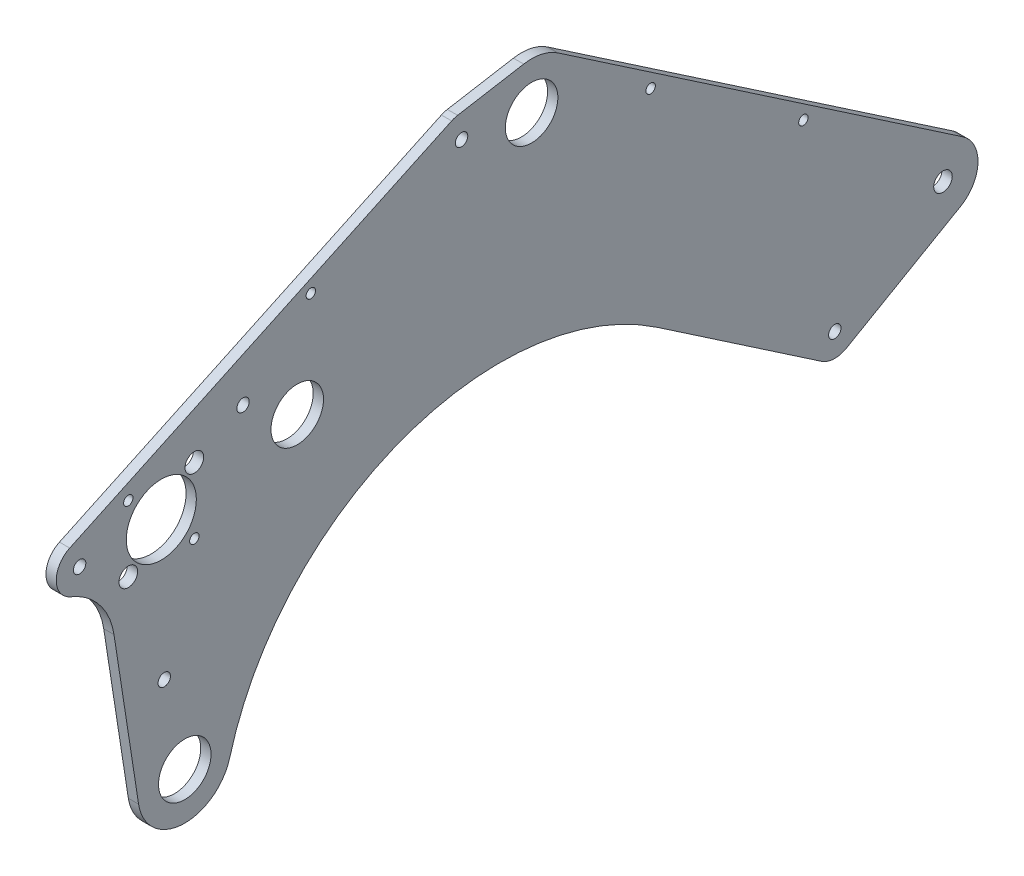
from build123d import *

# Parameters (mm, degrees)
SKETCH2_R           = 14.2875
SKETCH2_R_2         = 19.05
SKETCH2_R_3         = 5.0419
SKETCH2_R_4         = 3.3782
SKETCH2_R_5         = 5.08
SKETCH2_R_6         = 2.5527
BOSS_EXTRUDE1_DEPTH = 5.588
SKETCH4_R           = 2.5527
CUT_EXTRUDE1_DEPTH  = 512.363731997


with BuildPart() as part:
    # Sketch2 → Boss-Extrude1 (new body)
    with BuildSketch(Plane(origin=(0, 0, 0), x_dir=(0, 0, -1), z_dir=(1, 0, 0))):
        with BuildLine():
            Line((-437.546257165, -74.524343451), (-450.925675972, 12.053916333))
            ThreePointArc((-450.925675972, 12.053916333), (-458.738197339, 29.923843863), (-474.369924043, 41.586558826))
            ThreePointArc((-474.369924043, 41.586558826), (-482.328689132, 53.015195424), (-475.021326618, 64.870916799))
            Line((-475.021326618, 64.870916799), (-267.255494276, 162.202987762))
            ThreePointArc((-267.255494276, 162.202987762), (-265.669363705, 162.82010746), (-264.014960339, 163.219602661))
            Line((-264.014960339, 163.219602661), (-228.062096944, 169.38678303))
            ThreePointArc((-228.062096944, 169.38678303), (-218.387406017, 169.176022054), (-209.493675138, 165.362150558))
            Line((-209.493675138, 165.362150558), (10.705611447, 15.7572962))
            ThreePointArc((10.705611447, 15.7572962), (19.036817115, -0.708586016), (9.504578676, -16.509557359))
            Line((9.504578676, -16.509557359), (-52.513175494, -52.213278))
            ThreePointArc((-52.513175494, -52.213278), (-59.321951956, -53.898117837), (-65.986635577, -51.711770561))
            Line((-65.986635577, -51.711770561), (-155.192448972, 8.895250142))
            ThreePointArc((-155.192448972, 8.895250142), (-293.761109642, 25.752361384), (-387.928953664, -77.29060573))
            ThreePointArc((-387.928953664, -77.29060573), (-413.858126783, -96.005803383), (-437.546257165, -74.524343451))
        make_face()
        with Locations((-223.767823734, 144.352422291)):
            Circle(SKETCH2_R, mode=Mode.SUBTRACT)
        with Locations((-351.246969331, 65.939769964)):
            Circle(SKETCH2_R, mode=Mode.SUBTRACT)
        with Locations((-412.444222517, -70.645186775)):
            Circle(SKETCH2_R, mode=Mode.SUBTRACT)
        with Locations((-425.183656076, 53.370351328)):
            Circle(SKETCH2_R_2, mode=Mode.SUBTRACT)
        Circle(SKETCH2_R_3, mode=Mode.SUBTRACT)
        with Locations((-58.849561279, -41.206906428)):
            Circle(SKETCH2_R_4, mode=Mode.SUBTRACT)
        with Locations((-261.867823734, 150.702422291)):
            Circle(SKETCH2_R_4, mode=Mode.SUBTRACT)
        with Locations((-407.223143834, 71.330863571)):
            Circle(SKETCH2_R_5, mode=Mode.SUBTRACT)
        with Locations((-443.144168318, 71.330863571)):
            Circle(SKETCH2_R_6, mode=Mode.SUBTRACT)
        with Locations((-443.144168318, 35.409839086)):
            Circle(SKETCH2_R_5, mode=Mode.SUBTRACT)
        with Locations((-407.223143834, 35.409839086)):
            Circle(SKETCH2_R_6, mode=Mode.SUBTRACT)
        with Locations((-469.633656076, 53.370351328)):
            Circle(SKETCH2_R_4, mode=Mode.SUBTRACT)
        with Locations((-423.596156076, -22.829648672)):
            Circle(SKETCH2_R_4, mode=Mode.SUBTRACT)
        with Locations((-380.733656076, 85.120351328)):
            Circle(SKETCH2_R_4, mode=Mode.SUBTRACT)
    extrude(amount=BOSS_EXTRUDE1_DEPTH)

    # Sketch4 → Cut-Extrude1 (cut, through all)
    with BuildSketch(Plane(origin=(5.588, 0, 0), x_dir=(0, 0, -1), z_dir=(1, 0, 0))):
        with Locations((-343.872532824, 119.297935584)):
            Circle(SKETCH4_R)
        with Locations((-159.008566065, 123.385313086)):
            Circle(SKETCH4_R)
        with Locations((-75.935745884, 66.94508861)):
            Circle(SKETCH4_R)
    extrude(amount=-CUT_EXTRUDE1_DEPTH, mode=Mode.SUBTRACT)


solid = part.part
